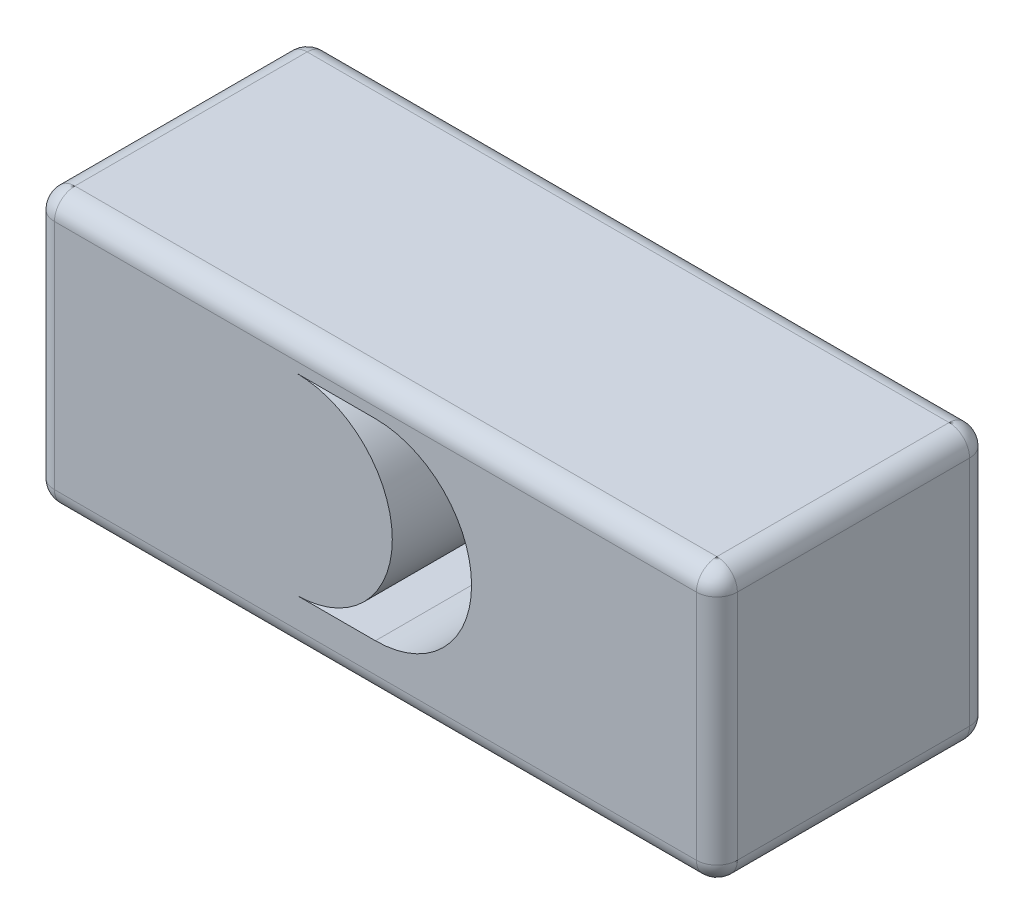
from build123d import *

# Parameters (mm, degrees)
ESQUISSE1_W             = 0.5
ESQUISSE1_H             = 0.2
BOSS_EXTRU_1_DEPTH      = 0.2
ENL_V_MAT_EXTRU_3_DEPTH = 1.397994975
CONG_1_R                = 0.015


with BuildPart() as part:
    # Esquisse1 → Boss.-Extru.1 (new body)
    with BuildSketch(Plane.XY):
        with Locations((0.03, -0.1)):
            Rectangle(ESQUISSE1_W, ESQUISSE1_H)
    extrude(amount=BOSS_EXTRU_1_DEPTH)

    # Esquisse2 → Enlèv. mat.-Extru.3 (cut, through all)
    with BuildSketch(Plane.XY.offset(0.2)):
        with BuildLine():
            Line((-0.028035468, -0.022535267), (0.03, -0.022535267))
            ThreePointArc((0.03, -0.022535267), (0.100399546, -0.092934813), (0.03, -0.163334358))
            Line((0.03, -0.163334358), (-0.028035468, -0.163334358))
            ThreePointArc((-0.028035468, -0.163334358), (0.042364078, -0.092934813), (-0.028035468, -0.022535267))
        make_face()
    extrude(amount=-ENL_V_MAT_EXTRU_3_DEPTH, mode=Mode.SUBTRACT)

    # Congé1
    cong_1_edges = [part.edges().sort_by_distance(p)[0] for p in [
        (0.03, -0.2, 0.2),
        (0.03, -0.2, 0),
        (-0.22, -0.1, 0.2),
        (-0.22, -0.2, 0.1),
        (-0.22, -0.1, 0),
        (0.28, -0.2, 0.1),
        (0.28, -0.1, 0.2),
        (0.28, -0.1, 0),
        (0.28, 0, 0.1),
        (0.03, 0, 0.2),
        (-0.22, 0, 0.1),
        (0.03, 0, 0),
    ]]
    fillet(cong_1_edges, radius=CONG_1_R)


solid = part.part
